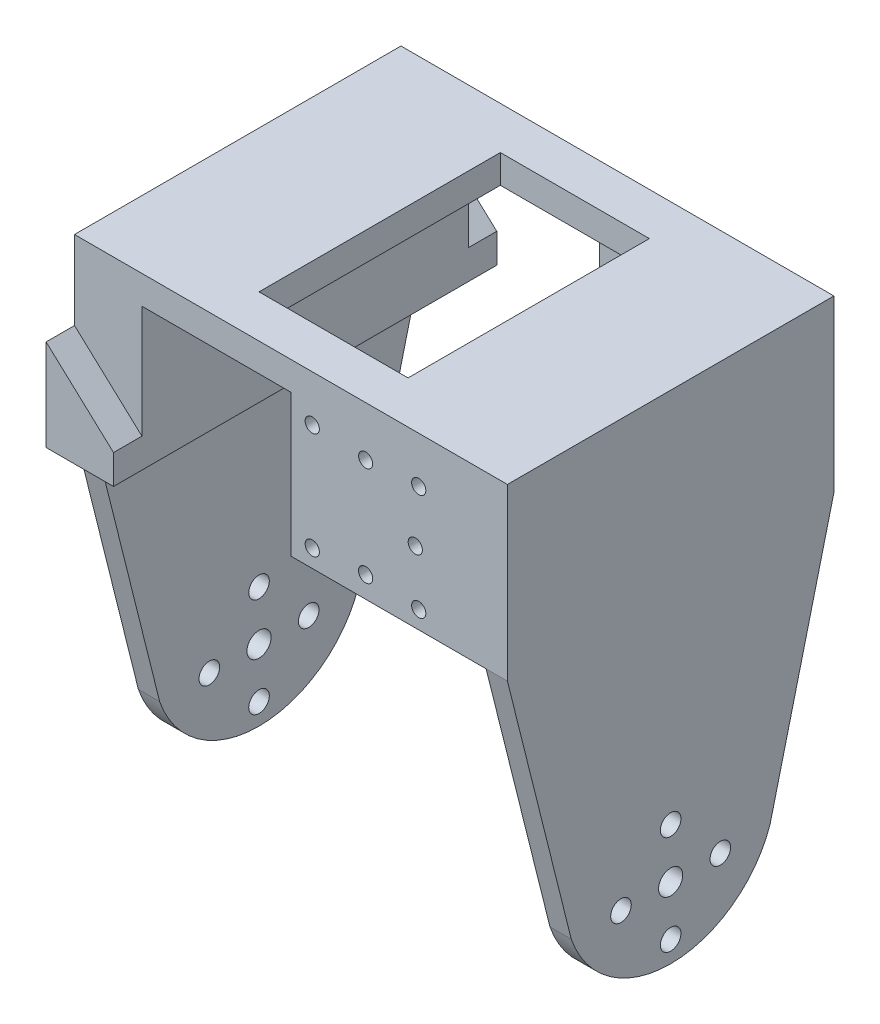
from build123d import *

# Parameters (mm, degrees)
SM_BASE_FLANGE_2_DEPTH = 28
SKETCH_15_W            = 61
SKETCH_15_H            = 46
EXTRUDE_1_DEPTH        = 12
SKETCH_18_W            = 21
SKETCH_18_H            = 2.5
SKETCH_18_W_2          = 42
SKETCH_18_H_2          = 41
CUT_EXTRUDE_1_DEPTH    = 20
SKETCH_19_R            = 1
CUT_EXTRUDE_2_DEPTH    = 69.163406605
SKETCH_20_W            = 21
SKETCH_20_H            = 34
CUT_EXTRUDE_3_DEPTH    = 4
EXTRUDE_2_DEPTH        = 3
PATTERN_LINEAR_1_COUNT = 2
PATTERN_LINEAR_1_PITCH = 58
SKETCH_23_R            = 1.45
SKETCH_23_R_2          = 1.7
CUT_EXTRUDE_4_DEPTH    = 82.792420187
SKETCH_24_R            = 1
SKETCH_24_R_2          = 0.99
CUT_EXTRUDE_5_DEPTH    = 69.163406605
EXTRUDE_3_DEPTH        = 4
PATTERN_LINEAR_2_COUNT = 2
PATTERN_LINEAR_2_PITCH = 50


# Sheet-metal steps are written as plain solids
with BuildPart() as part:
    # 草图1 → 基体-法兰2 (new body)
    with BuildSketch(Plane.XY):
        with BuildLine():
            Line((-27.5, -30), (-27.5, 23))
            ThreePointArc((-27.5, 23), (-26.914213562, 24.414213562), (-25.5, 25))
            Line((-25.5, 25), (25.5, 25))
            ThreePointArc((25.5, 25), (26.914213562, 24.414213562), (27.5, 23))
            Line((27.5, 23), (27.5, -30))
            Line((27.5, -30), (30.5, -30))
            Line((30.5, -30), (30.5, 23))
            ThreePointArc((30.5, 23), (29.035533906, 26.535533906), (25.5, 28))
            Line((25.5, 28), (-25.5, 28))
            ThreePointArc((-25.5, 28), (-29.035533906, 26.535533906), (-30.5, 23))
            Line((-30.5, 23), (-30.5, -30))
            Line((-30.5, -30), (-27.5, -30))
        make_face()
    extrude(amount=SM_BASE_FLANGE_2_DEPTH)

    # 草图15 → 凸台-拉伸1 (add, symmetric)
    with BuildSketch(Plane(origin=(0, 28, 0), x_dir=(1, 0, 0), z_dir=(0, 1, 0))):
        with Locations((0, -14)):
            Rectangle(SKETCH_15_W, SKETCH_15_H)
    extrude(amount=EXTRUDE_1_DEPTH, both=True)

    # 草图18 → 切除-拉伸1 (cut)
    with BuildSketch(Plane.XZ.offset(-16)):
        with Locations((-10.5, 35.75)):
            Rectangle(SKETCH_18_W, SKETCH_18_H)
        with Locations((0, 14)):
            Rectangle(SKETCH_18_W_2, SKETCH_18_H_2)
        with Locations((-10.5, -7.75)):
            Rectangle(SKETCH_18_W, SKETCH_18_H)
    extrude(amount=-CUT_EXTRUDE_1_DEPTH, mode=Mode.SUBTRACT)

    # 草图19 → 切除-拉伸2 (cut, through all)
    with BuildSketch(Plane.XY.offset(37)):
        with Locations((3, 18.5)):
            Circle(SKETCH_19_R)
        with Locations(Location((18, 18.5, 0), (0, 0, 180))):
            Circle(SKETCH_19_R)
        with Locations((18, 33.5)):
            Circle(SKETCH_19_R)
        with Locations(Location((3, 33.5, 0), (0, 0, 180))):
            Circle(SKETCH_19_R)
    extrude(amount=-CUT_EXTRUDE_2_DEPTH, mode=Mode.SUBTRACT)

    # 草图20 → 切除-拉伸3 (cut)
    with BuildSketch(Plane.XZ.offset(-36)):
        with Locations((0, 14)):
            Rectangle(SKETCH_20_W, SKETCH_20_H)
    extrude(amount=-CUT_EXTRUDE_3_DEPTH, mode=Mode.SUBTRACT)

    # 草图21 → 凸台-拉伸2 (add)
    with BuildSketch(Plane.ZY.offset(30.5)):
        Polygon((0, 16), (-9, 16), (0, -20), align=None)
        Polygon((28, 16), (28, -20), (37, 16), align=None)
    extrude_2 = extrude(amount=-EXTRUDE_2_DEPTH)

    # 阵列(线性)1: 凸台-拉伸2 ×2
    with Locations(*[(i * PATTERN_LINEAR_1_PITCH, 0, 0) for i in range(1, PATTERN_LINEAR_1_COUNT)]):
        add(extrude_2)

    # 草图23 → 切除-拉伸4 (cut, through all)
    with BuildSketch(Plane.ZY.offset(30.5)):
        with Locations(Location((14, -13, 0), (0, 0, 270))):
            Circle(SKETCH_23_R)
        with Locations(Location((7, -20, 0), (0, 0, 270))):
            Circle(SKETCH_23_R)
        with Locations(Location((14, -20, 0), (0, 0, 270))):
            Circle(SKETCH_23_R_2)
        with Locations(Location((21, -20, 0), (0, 0, 270))):
            Circle(SKETCH_23_R)
        with Locations(Location((14, -27, 0), (0, 0, 270))):
            Circle(SKETCH_23_R)
        with BuildLine():
            Line((0, -30), (14, -30))
            ThreePointArc((14, -30), (5.397674733, -27.243255374), (0, -20))
            Line((0, -20), (0, -30))
        make_face()
        with BuildLine():
            Line((14, -30), (28, -30))
            Line((28, -30), (28, -20))
            ThreePointArc((28, -20), (22.602325267, -27.243255374), (14, -30))
        make_face()
    extrude(amount=-CUT_EXTRUDE_4_DEPTH, mode=Mode.SUBTRACT)

    # 草图24 → 切除-拉伸5 (cut, through all)
    with BuildSketch(Plane(origin=(0, 0, -9), x_dir=(-1, 0, 0), z_dir=(0, 0, -1))):
        with Locations((-17.52, 26)):
            Circle(SKETCH_24_R)
        with Locations((-10.52, 19)):
            Circle(SKETCH_24_R)
        with Locations((-10.52, 33)):
            Circle(SKETCH_24_R_2)
    extrude(amount=-CUT_EXTRUDE_5_DEPTH, mode=Mode.SUBTRACT)

    # 草图25 → 凸台-拉伸3 (add)
    with BuildSketch(Plane(origin=(0, 0, -9), x_dir=(-1, 0, 0), z_dir=(0, 0, -1))):
        Polygon((30.5, 28.892731946), (21, 20.141290546), (21, 16), (27.5, 16), (30.5, 16), align=None)
    extrude_3 = extrude(amount=EXTRUDE_3_DEPTH)

    # 阵列(线性)2: 凸台-拉伸3 ×2
    with Locations(*[(0, 0, i * PATTERN_LINEAR_2_PITCH) for i in range(1, PATTERN_LINEAR_2_COUNT)]):
        add(extrude_3)


solid = part.part
